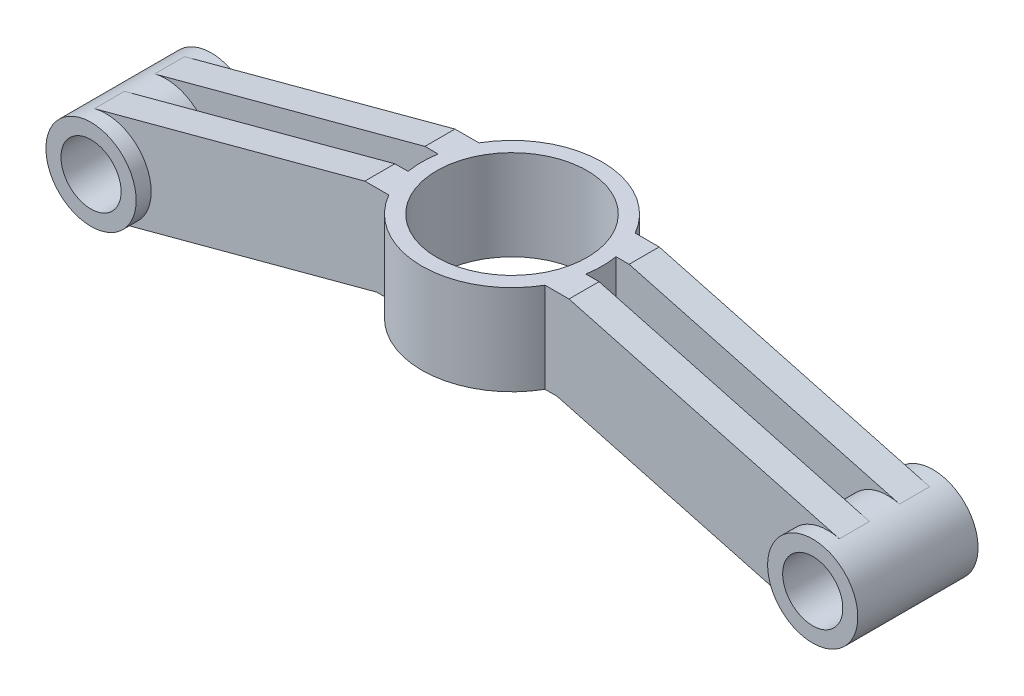
from build123d import *

# Parameters (mm, degrees)
SKETCH1_R           = 10
BOSS_EXTRUDE1_DEPTH = 40
BOSS_EXTRUDE2_START = -5
BOSS_EXTRUDE2_DEPTH = 10
BOSS_EXTRUDE3_START = -25
BOSS_EXTRUDE3_DEPTH = 10
SKETCH4_R           = 30
SKETCH4_R_2         = 25
BOSS_EXTRUDE4_DEPTH = 30
CUT_EXTRUDE3_START  = 50
SKETCH5_R           = 25
CUT_EXTRUDE3_DEPTH  = 50


with BuildPart() as part:
    # Sketch1 → Boss-Extrude1 (new body)
    with BuildSketch(Plane.XY):
        with BuildLine():
            ThreePointArc((-123.882285677, 14.488887394), (-134.488887394, -3.882285677), (-116.117714323, -14.488887394))
            ThreePointArc((-116.117714323, -14.488887394), (-108.099699896, -9.131421435), (-105, 0))
            ThreePointArc((-105, 0), (-110.868578565, 11.900300104), (-123.882285677, 14.488887394))
        make_face()
        with Locations((-120, 0)):
            Circle(SKETCH1_R, mode=Mode.SUBTRACT)
    extrude(amount=-BOSS_EXTRUDE1_DEPTH)

    # Sketch2 → Boss-Extrude2 (add)
    with BuildSketch(Plane.XY.offset(BOSS_EXTRUDE2_START)):
        with BuildLine():
            Line((0, 38.586284613), (0, 8.586284613))
            Line((0, 8.586284613), (-30, 8.586284613))
            Line((-30, 8.586284613), (-116.117714323, -14.488887394))
            ThreePointArc((-116.117714323, -14.488887394), (-105.511112606, 3.882285677), (-123.882285677, 14.488887394))
            Line((-123.882285677, 14.488887394), (-33.949574928, 38.586284613))
            Line((-33.949574928, 38.586284613), (0, 38.586284613))
        make_face()
    extrude(amount=-BOSS_EXTRUDE2_DEPTH)

    # Sketch3 → Boss-Extrude3 (add)
    with BuildSketch(Plane.XY.offset(BOSS_EXTRUDE3_START)):
        with BuildLine():
            Line((-116.117714323, -14.488887394), (-30, 8.586284613))
            Line((-30, 8.586284613), (0, 8.586284613))
            Line((0, 8.586284613), (0, 38.586284613))
            Line((0, 38.586284613), (-33.949574928, 38.586284613))
            Line((-33.949574928, 38.586284613), (-123.882285677, 14.488887394))
            ThreePointArc((-123.882285677, 14.488887394), (-105.511112606, 3.882285677), (-116.117714323, -14.488887394))
        make_face()
    extrude(amount=-BOSS_EXTRUDE3_DEPTH)

    # Mirror1: part across plane


with BuildPart() as part_1:
    add(part.part)
    add(part.part.mirror(Plane(origin=(0, 0, 0), x_dir=(0, 0, 1), z_dir=(1, 0, 0))))

    # Sketch4 → Boss-Extrude4 (add)
    with BuildSketch(Plane(origin=(0, 38.586284613, 0), x_dir=(1, 0, 0), z_dir=(0, 1, 0))):
        with Locations((0, 20)):
            Circle(SKETCH4_R)
        with Locations((0, 20)):
            Circle(SKETCH4_R_2, mode=Mode.SUBTRACT)
    extrude(amount=-BOSS_EXTRUDE4_DEPTH)

    # Sketch5 → Cut-Extrude3 (cut)
    with BuildSketch(Plane(origin=(0, 0, 0), x_dir=(1, 0, 0), z_dir=(0, 1, 0)).offset(CUT_EXTRUDE3_START)):
        with Locations((0, 20)):
            Circle(SKETCH5_R)
    extrude(amount=-CUT_EXTRUDE3_DEPTH, mode=Mode.SUBTRACT)


solid = part_1.part
